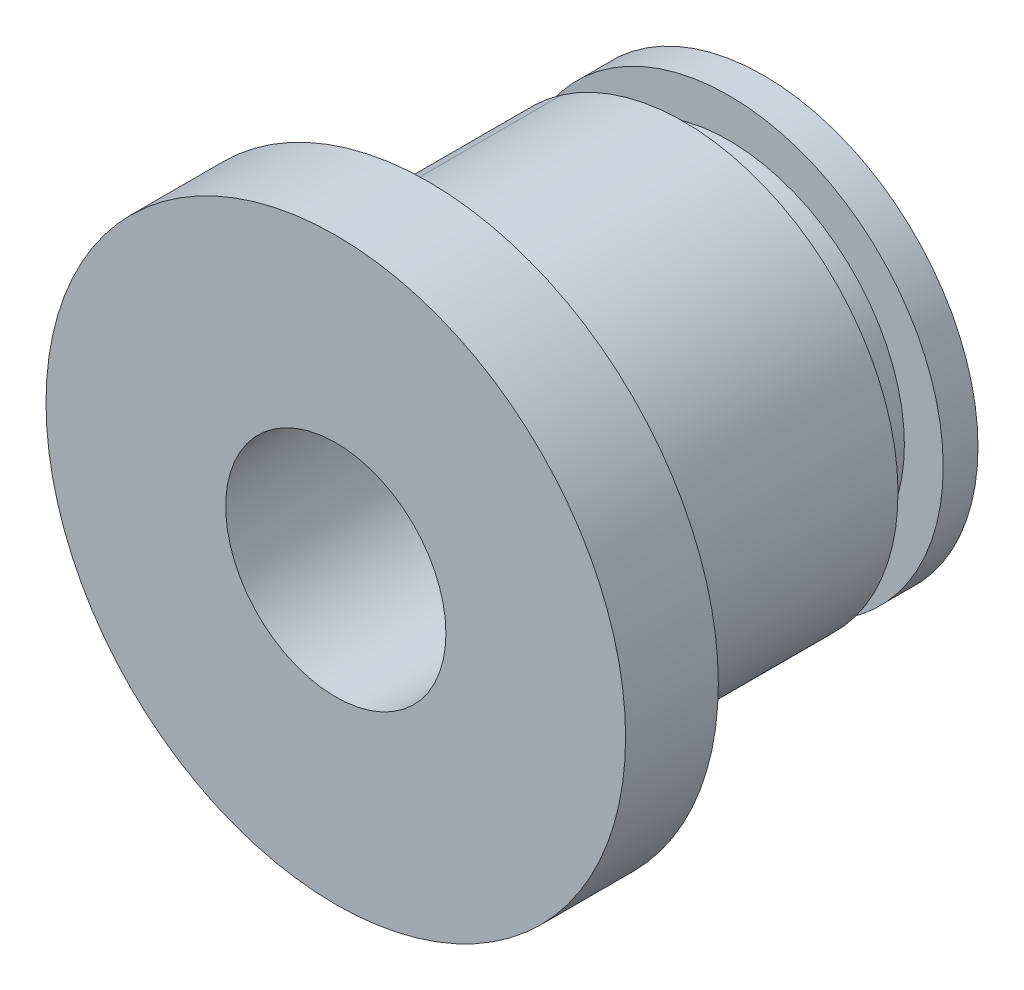
from build123d import *

# Parameters (mm, degrees)
SKETCH1_R           = 6.35
BOSS_EXTRUDE1_DEPTH = 2.032
SKETCH2_R           = 4.699
BOSS_EXTRUDE2_DEPTH = 7.3406
SKETCH4_W           = 0.9906
SKETCH4_H           = 0.8509
SKETCH8_R           = 2.413
CUT_EXTRUDE2_DEPTH  = 15.24


with BuildPart() as part:
    # Sketch1 → Boss-Extrude1 (new body)
    with BuildSketch(Plane.XY):
        Circle(SKETCH1_R)
    extrude(amount=BOSS_EXTRUDE1_DEPTH)

    # Sketch2 → Boss-Extrude2 (add)
    with BuildSketch(Plane(origin=(0, 0, 0), x_dir=(-1, 0, 0), z_dir=(0, 0, -1))):
        Circle(SKETCH2_R)
    extrude(amount=BOSS_EXTRUDE2_DEPTH)

    # Sketch4 → Cut-Revolve1 (revolve, cut)
    with BuildSketch(Plane(origin=(0, 0, 0), x_dir=(0, 0, -1), z_dir=(1, 0, 0))):
        with Locations((6.0833, 4.27355)):
            Rectangle(SKETCH4_W, SKETCH4_H)
    revolve(axis=Axis((0, 0, 6.549062663), (0, 0, -1)), mode=Mode.SUBTRACT)

    # Sketch8 → Cut-Extrude2 (cut)
    with BuildSketch(Plane.XY.offset(2.032)):
        Circle(SKETCH8_R)
    extrude(amount=-CUT_EXTRUDE2_DEPTH, mode=Mode.SUBTRACT)


solid = part.part
